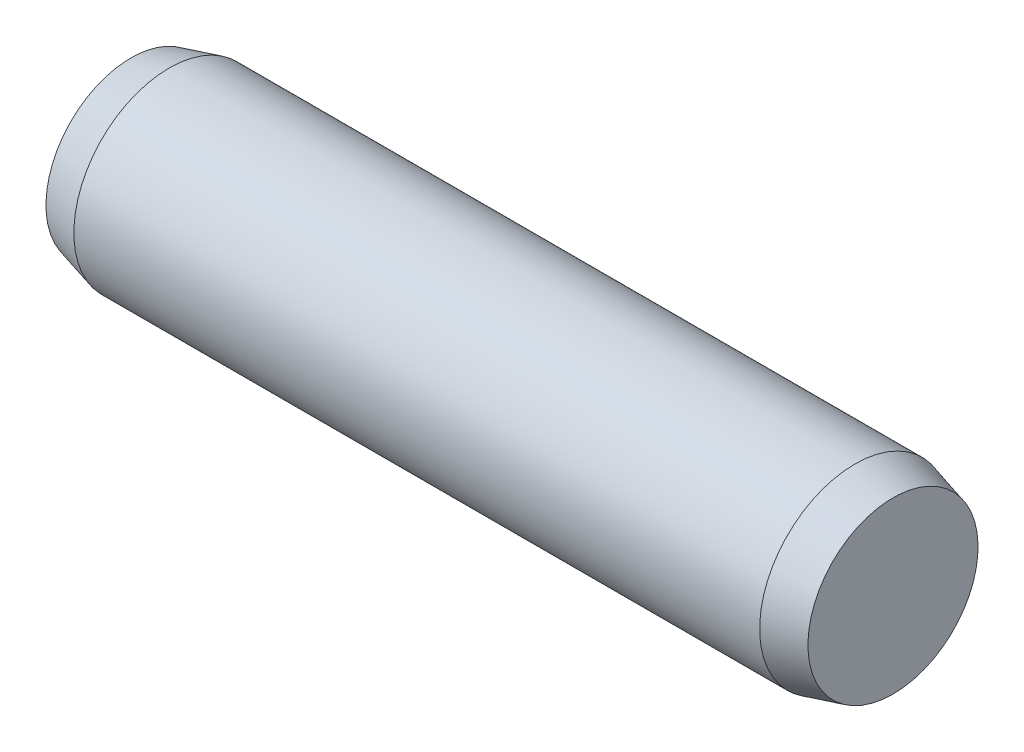
from build123d import *


with BuildPart() as part:
    # Sketch2 → Body (revolve)
    with BuildSketch(Plane.XY):
        Polygon((6, 0.669615242), (6, 0), (0, 0), (0, 0.669615242), (0.3, 0.75), (5.7, 0.75), align=None)
    revolve(axis=Axis((0, 0, 0), (1, 0, 0)))


solid = part.part
